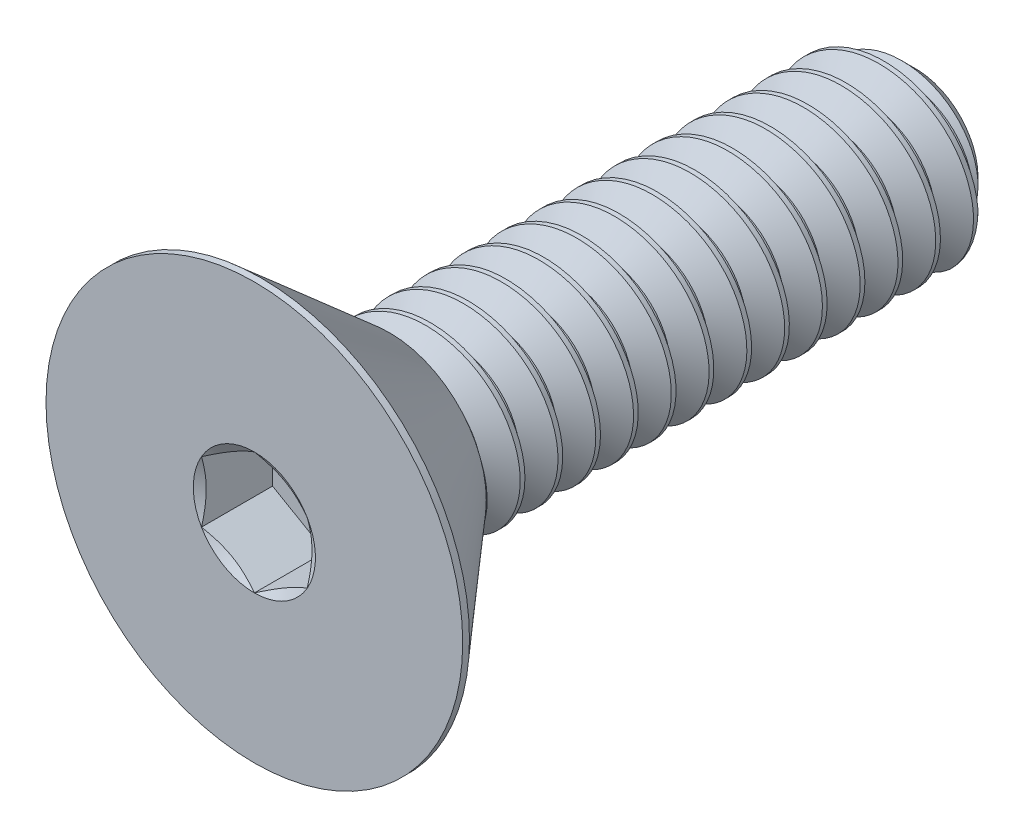
from build123d import *

# Parameters (mm, degrees)
CUT_EXTRUDE1_DEPTH = 0.85344
CUT_SWEEP1_PITCH   = 0.453571429
CUT_SWEEP1_TO      = 6.3119


with BuildPart() as part:
    # Sketch3 → Revolve1 (revolve)
    with BuildSketch(Plane(origin=(0, 0, 0), x_dir=(0, 0, -1), z_dir=(1, 0, 0)), mode=Mode.PRIVATE) as revolve1_sk:
        Polygon((-3.96875, 0), (3.96875, 0), (3.96875, 0.752021429), (3.628571429, 1.0922), (-2.34315, 1.0922), (-2.34315, 1.159443105), (-3.88747, 2.5019), (-3.96875, 2.5019), align=None)
    revolve(revolve1_sk.sketch.rotate(Axis((0, 0, 3.96875), (0, 0, -1)), 180), axis=Axis((0, 0, 3.96875), (0, 0, -1)))

    # Sketch4 → Cut-Extrude1 (cut)
    with BuildSketch(Plane.XY.offset(3.96875)):
        Polygon((0.635, -0.366617421), (0.635, 0.366617421), (0, 0.733234842), (-0.635, 0.366617421), (-0.635, -0.366617421), (0, -0.733234842), align=None)
    extrude(amount=-CUT_EXTRUDE1_DEPTH, mode=Mode.SUBTRACT)

    # Cut-Extrude2 cone 1 section (through the dimple's axis) → Cut-Extrude2 (revolve, cut)
    with BuildSketch(Plane(origin=(0, 0, 3.96875), x_dir=(0, -1, 0), z_dir=(1, 0, 0))):
        Polygon((0, 0), (0.733234842, 0), (0, 0.423333333), align=None)
    revolve(axis=Axis((0, 0, 3.96875), (0, 0, -1)), mode=Mode.SUBTRACT)


with BuildPart() as body_2:
    # Split1: the piece on the far side of the plane
    add(part.part)
    split(bisect_by=Plane.XY.offset(2.34315), keep=Keep.BOTTOM)

    # Cut-Sweep1: arcs per turn and ends read off the stored shape
    # Cut-Sweep1: the profile of Sketch8 screwed along a right-hand helix through 18.5 turns, 6 arcs to a turn; built about Z, then put on its axis
    cut_sweep1_z = Axis((0, 0, 0), (0, 0, 1))
    cut_sweep1_corners = [(1.116750274, 0, 0.014174107), (1.116750274, 0, -0.411049107), (0.797596715, 0, -0.226785714), (0.797596715, 0, -0.170089286)]
    with BuildLine(mode=Mode.PRIVATE) as cut_sweep1_profile:
        Line(cut_sweep1_corners[0], cut_sweep1_corners[1])
        Line(cut_sweep1_corners[1], cut_sweep1_corners[2])
        Line(cut_sweep1_corners[2], cut_sweep1_corners[3])
        Line(cut_sweep1_corners[3], cut_sweep1_corners[0])
    cut_sweep1_cap = Face(cut_sweep1_profile.wire())
    cut_sweep1_turn_angles = [0, 30, 60, 90, 120, 150, 180, 210, 240, 270, 300, 330, 360]
    cut_sweep1_turn_weights = [1, 0.8660254037844387, 1, 0.8660254037844387, 1, 0.8660254037844387, 1, 0.8660254037844387, 1, 0.8660254037844387, 1, 0.8660254037844387, 1]
    cut_sweep1_turn_rails = [Edge.make_bspline([Vector(p[0], p[1], 0).rotate(cut_sweep1_z, cut_sweep1_turn_angles[k]) / cut_sweep1_turn_weights[k] + Vector(0, 0, p[2] + CUT_SWEEP1_PITCH * cut_sweep1_turn_angles[k] / 360) for k in range(13)], [0, 0, 0, 1, 1, 2, 2, 3, 3, 4, 4, 5, 5, 6, 6, 6], 2, cut_sweep1_turn_weights) for p in cut_sweep1_corners]
    cut_sweep1_turn_sides = [Face.make_surface_from_curves(cut_sweep1_turn_rails[p[0]], cut_sweep1_turn_rails[p[1]]) for p in [(0, 1), (1, 2), (2, 3), (3, 0)]]
    cut_sweep1_last_angles = [6480, 6510, 6540, 6570, 6600, 6630, 6660]
    cut_sweep1_last_weights = [1, 0.8660254037844387, 1, 0.8660254037844387, 1, 0.8660254037844466, 1]
    cut_sweep1_last_rails = [Edge.make_bspline([Vector(p[0], p[1], 0).rotate(cut_sweep1_z, cut_sweep1_last_angles[k]) / cut_sweep1_last_weights[k] + Vector(0, 0, p[2] + CUT_SWEEP1_PITCH * cut_sweep1_last_angles[k] / 360) for k in range(7)], [0, 0, 0, 1, 1, 2, 2, 3, 3, 3], 2, cut_sweep1_last_weights) for p in cut_sweep1_corners]
    cut_sweep1_last_sides = [Face.make_surface_from_curves(cut_sweep1_last_rails[p[0]], cut_sweep1_last_rails[p[1]]) for p in [(0, 1), (1, 2), (2, 3), (3, 0)]]
    cut_sweep1 = Plane(origin=(0, 0, -3.96875), x_dir=(0, 1, 0), z_dir=(0, 0, 1)) * split(Solid(Shell([*[p.moved(Location((0, 0, CUT_SWEEP1_PITCH * i))) for i in range(18) for p in cut_sweep1_turn_sides], *cut_sweep1_last_sides, cut_sweep1_cap, cut_sweep1_cap.rotate(cut_sweep1_z, 6660).moved(Location((0, 0, CUT_SWEEP1_PITCH * 6660 / 360)))])), bisect_by=Plane.XY.offset(CUT_SWEEP1_TO), keep=Keep.BOTTOM, mode=Mode.PRIVATE)
    add(cut_sweep1, mode=Mode.SUBTRACT)


with BuildPart() as part_1:
    add(part.part)

    # Split1
    split(bisect_by=Plane.XY.offset(2.34315), keep=Keep.TOP)

    # Combine2: union body 2
    add(body_2.part)


solid = part_1.part
